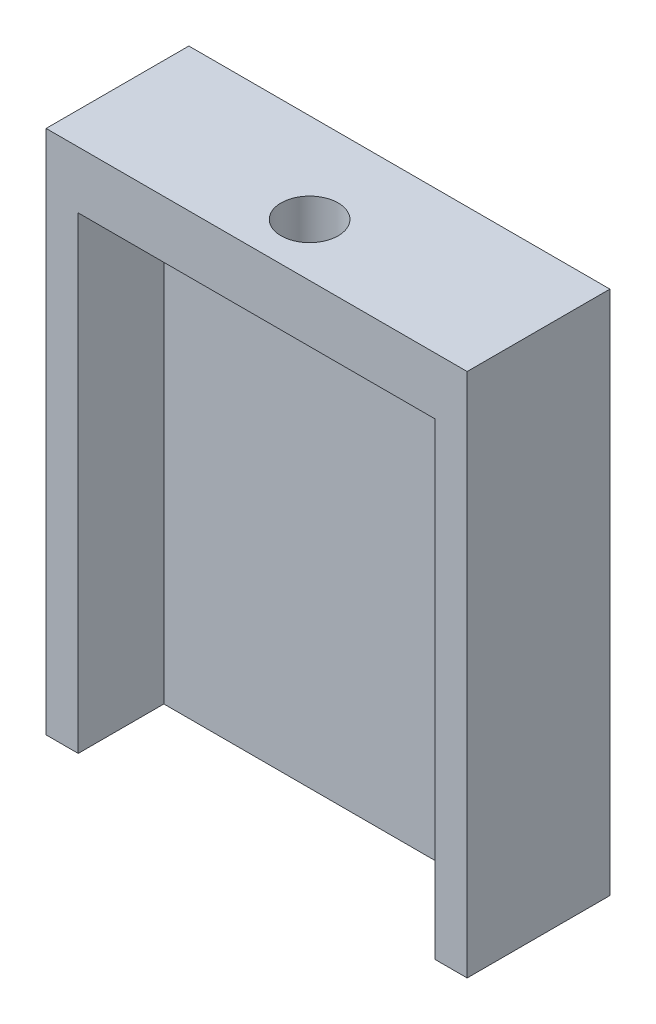
from build123d import *

# Parameters (mm, degrees)
BOSS_EXTRUDE1_DEPTH = 16.4
BOSS_EXTRUDE2_DEPTH = 2
SKETCH3_R           = 1
CUT_EXTRUDE1_DEPTH  = 21.222635369


with BuildPart() as part:
    # Sketch1 → Boss-Extrude1 (new body)
    with BuildSketch(Plane(origin=(0, 0, 0), x_dir=(1, 0, 0), z_dir=(0, 1, 0))):
        Polygon((-7.375, -1), (-7.375, -4.000544496), (-6.25, -4.000544496), (-6.25, -1), (6.25, -1), (6.25, -4.000544496), (7.375, -4.000544496), (7.375, -1), (7.375, 1), (-7.375, 1), align=None)
    extrude(amount=BOSS_EXTRUDE1_DEPTH)

    # Sketch2 → Boss-Extrude2 (add)
    with BuildSketch(Plane(origin=(0, 16.4, 0), x_dir=(1, 0, 0), z_dir=(0, 1, 0))):
        Polygon((-6.25, -4.000544496), (6.25, -4.000544496), (7.375, -4.000544496), (7.375, 1), (-7.375, 1), (-7.375, -4.000544496), align=None)
    extrude(amount=BOSS_EXTRUDE2_DEPTH)

    # Sketch3 → Cut-Extrude1 (cut, through all)
    with BuildSketch(Plane(origin=(0, 18.4, 0), x_dir=(1, 0, 0), z_dir=(0, 1, 0))):
        with Locations((0, -2.144895844)):
            Circle(SKETCH3_R)
    extrude(amount=-CUT_EXTRUDE1_DEPTH, mode=Mode.SUBTRACT)


solid = part.part
